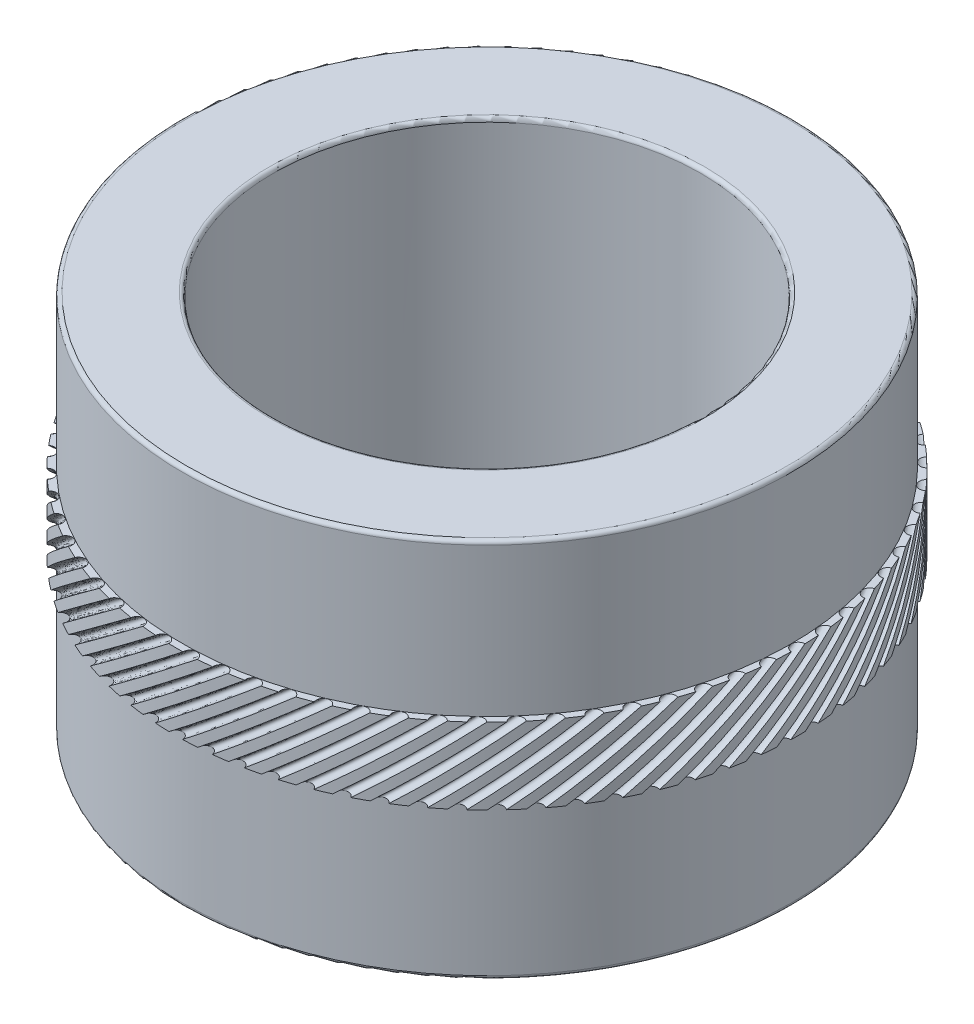
from build123d import *

# Parameters (mm, degrees)
CUT_SWEEP1_PITCH       = 25.4
CUT_SWEEP1_HEIGHT      = 1.27
CUT_SWEEP1_RADIUS      = 5.1943
CUT_SWEEP1_START_ANGLE = 90
SKETCH4_R              = 0.113340029
CIRPATTERN1_COUNT      = 70
FILLET1_R              = 0.0635


with BuildPart() as part:
    # Sketch2 → Revolve1 (revolve)
    with BuildSketch(Plane.XY, mode=Mode.PRIVATE) as revolve1_sk:
        Polygon((-3.5687, 6.35), (-5.08, 6.35), (-5.08, 3.81), (-5.1943, 3.81), (-5.1943, 2.54), (-5.08, 2.54), (-5.08, 0), (-3.5687, 0), align=None)
    revolve(revolve1_sk.sketch.rotate(Axis((0, 0, 0), (0, 1, 0)), 270), axis=Axis((0, 0, 0), (0, 1, 0)))

    # Cut-Sweep1: sweep along a helix
    with BuildLine() as cut_sweep1_path:
        add(Helix(CUT_SWEEP1_PITCH, CUT_SWEEP1_HEIGHT, CUT_SWEEP1_RADIUS, center=(0, 3.81, 0), direction=(0, -1, 0), mode=Mode.PRIVATE).rotate(Axis((0, 3.81, 0), (0, -1, 0)), CUT_SWEEP1_START_ANGLE))
    # Sketch4 → Cut-Sweep1 (sweep, cut)
    with BuildSketch(Plane(origin=(0, 3.81, 0), x_dir=(1, 0, 0), z_dir=(0, 1, 0))):
        with Locations((5.1943, 0)):
            Circle(SKETCH4_R)
    cut_sweep1 = sweep(path=cut_sweep1_path.line, is_frenet=True, mode=Mode.SUBTRACT)

    # CirPattern1: Cut-Sweep1 ×70 about axis
    cirpattern1_axis = Axis((0, 0, 0), (0, -1, 0))
    for i in range(1, CIRPATTERN1_COUNT):
        add(cut_sweep1.rotate(cirpattern1_axis, i * 360 / CIRPATTERN1_COUNT), mode=Mode.SUBTRACT)

    # Fillet1
    fillet1_edges = [part.edges().sort_by_distance(p)[0] for p in [
        (0, 6.35, 3.5687),
        (0, 6.35, 5.08),
        (0, 0, 5.08),
        (0, 0, 3.5687),
    ]]
    fillet(fillet1_edges, radius=FILLET1_R)


solid = part.part
